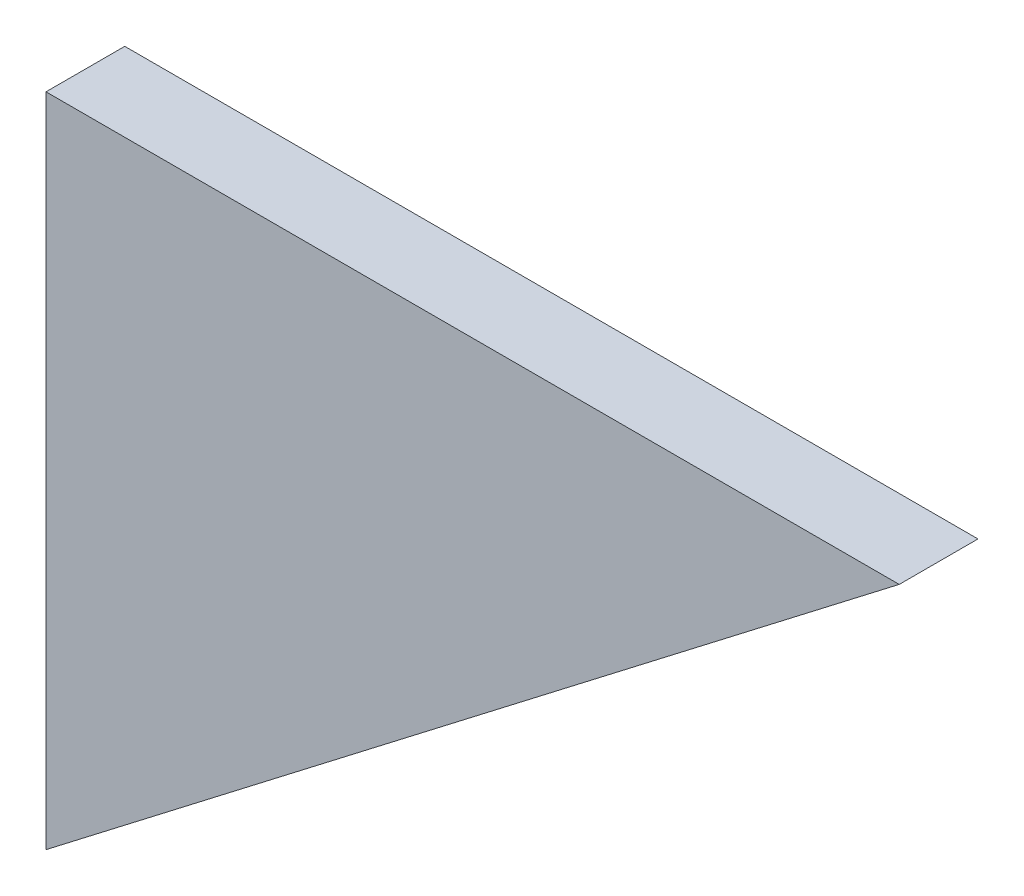
from build123d import *

# Parameters (mm, degrees)
EXTRUDE_1_DEPTH = 6


with BuildPart() as part:
    # Эскиз1 → Бобышка-Вытянуть1 (new body)
    with BuildSketch(Plane.XY):
        Polygon((6, -293.846153846), (6, -343.846153846), (71, -293.846153846), align=None)
    extrude(amount=-EXTRUDE_1_DEPTH)


solid = part.part
